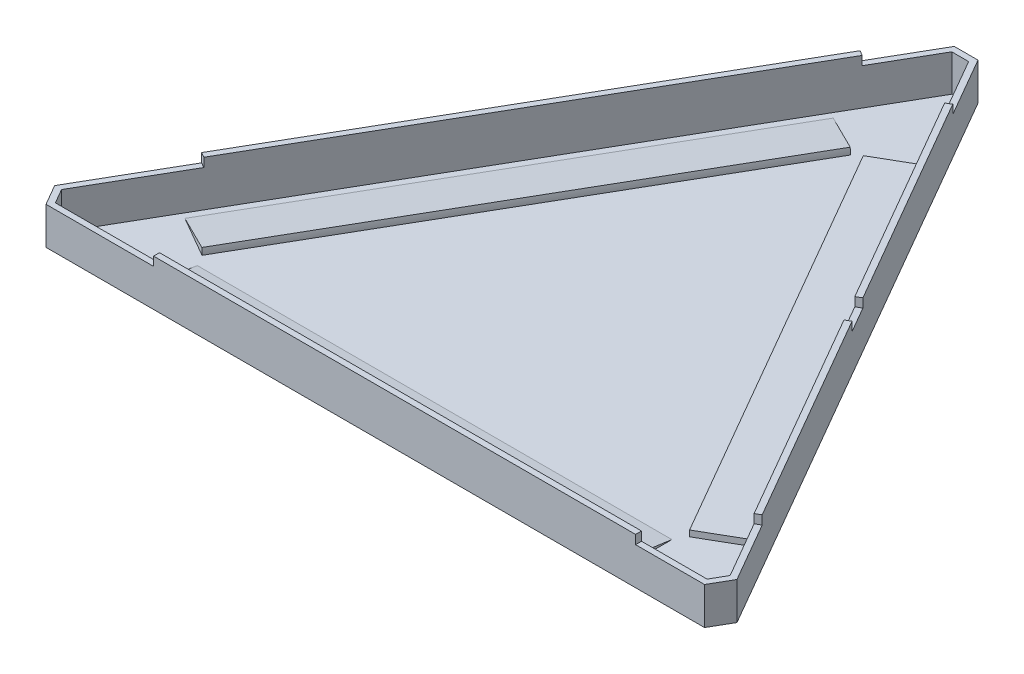
from build123d import *

# Parameters (mm, degrees)
BOSS_EXTRUDE1_DEPTH = 0.2
BOSS_EXTRUDE2_DEPTH = 12.58
SKETCH1_4_W         = 162.49
SKETCH1_4_H         = 2
BOSS_EXTRUDE3_DEPTH = 15.58
BOSS_EXTRUDE5_DEPTH = 2
SKETCH3_7_W         = 160
SKETCH3_7_H         = 15.8
REVOLVE3_ANGLE      = 8
REVOLVE4_ANGLE      = 8


# Read off the part's stored shape, not the designer's step: Boss-Extrude2
with BuildPart() as part:
    # Sketch1 → Boss-Extrude1 (new body)
    with BuildSketch(Plane(origin=(0, 0, 0), x_dir=(1, 0, 0), z_dir=(0, 1, 0))):
        Polygon((-115, 0), (-111, -6.92820323), (111, -6.92820323), (115, 0), (15.625, 172.122549002), (13.892949192, 171.122549002), (2.845299462, 190.25763964), (-2.845299462, 190.25763964), (-13.892949192, 171.122549002), (-15.625, 172.122549002), align=None)
    extrude(amount=BOSS_EXTRUDE1_DEPTH)

    # Boss-Extrude2 outline → Boss-Extrude2 (add)
    with BuildSketch(Plane(origin=(0, 0, 0), x_dir=(1, 0, 0), z_dir=(0, 1, 0))):
        Polygon((15.625, 172.122549002), (4, 192.25763964), (-4, 192.25763964), (-15.625, 172.122549002), (-13.892949192, 171.122549002), (-2.845299462, 190.25763964), (2.845299462, 190.25763964), (13.892949192, 171.122549002), align=None)
        Polygon((62, 91.798692801), (57, 100.458946839), (55.267949192, 99.458946839), (60.267949192, 90.798692801), align=None)
        Polygon((-95.137949192, 30.402081141), (-96.87, 31.402081141), (-115, 0), (-111, -6.92820323), (-74.74, -6.92820323), (-74.74, -4.92820323), (-109.845299462, -4.92820323), (-112.690598923, 0), align=None)
        Polygon((115, 0), (103.375, 20.135090638), (101.642949192, 19.135090638), (112.690598923, 0), (109.845299462, -4.92820323), (87.75, -4.92820323), (87.75, -6.92820323), (111, -6.92820323), align=None)
    extrude(amount=BOSS_EXTRUDE2_DEPTH)

    # Sketch1<4> → Boss-Extrude3 (add)
    with BuildSketch(Plane(origin=(0, 0, 0), x_dir=(1, 0, 0), z_dir=(0, 1, 0))):
        Polygon((-15.625, 172.122549002), (-96.87, 31.402081141), (-95.137949192, 30.402081141), (-13.892949192, 171.122549002), align=None)
        with Locations((6.505, -5.92820323)):
            Rectangle(SKETCH1_4_W, SKETCH1_4_H)
        Polygon((57, 100.458946839), (15.625, 172.122549002), (13.892949192, 171.122549002), (55.267949192, 99.458946839), align=None)
        Polygon((101.642949192, 19.135090638), (103.375, 20.135090638), (62, 91.798692801), (60.267949192, 90.798692801), align=None)
    extrude(amount=BOSS_EXTRUDE3_DEPTH)

    # Sketch3 → Boss-Extrude5 (add)
    with BuildSketch(Plane(origin=(0, 0.2, 0), x_dir=(1, 0, 0), z_dir=(0, 1, 0))):
        Polygon((2.179491924, 155.410852123), (15.862693304, 163.310852123), (95.862693304, 24.746787517), (82.179491924, 16.846787517), align=None)
    extrude(amount=BOSS_EXTRUDE5_DEPTH)

    # Sketch3<7> → Revolve3 (revolve)
    with BuildSketch(Plane(origin=(0, 0.2, 0), x_dir=(1, 0, 0), z_dir=(0, 1, 0))):
        with Locations((0, 5.17179677)):
            Rectangle(SKETCH3_7_W, SKETCH3_7_H)
    revolve(axis=Axis((80, 0.2, -13.07179677), (-1, 0, 0)), revolution_arc=REVOLVE3_ANGLE)

    # Sketch3<8> → Revolve4 (revolve)
    with BuildSketch(Plane(origin=(0, 0.2, 0), x_dir=(1, 0, 0), z_dir=(0, 1, 0))):
        Polygon((-15.862693304, 163.310852123), (-2.179491924, 155.410852123), (-42.179491924, 86.12881982), (-82.179491924, 16.846787517), (-95.862693304, 24.746787517), align=None)
    revolve(axis=Axis((-95.862693304, 0.2, -24.746787517), (-0.500000000000001, 0, 0.866025403784438)), revolution_arc=REVOLVE4_ANGLE)


solid = part.part
